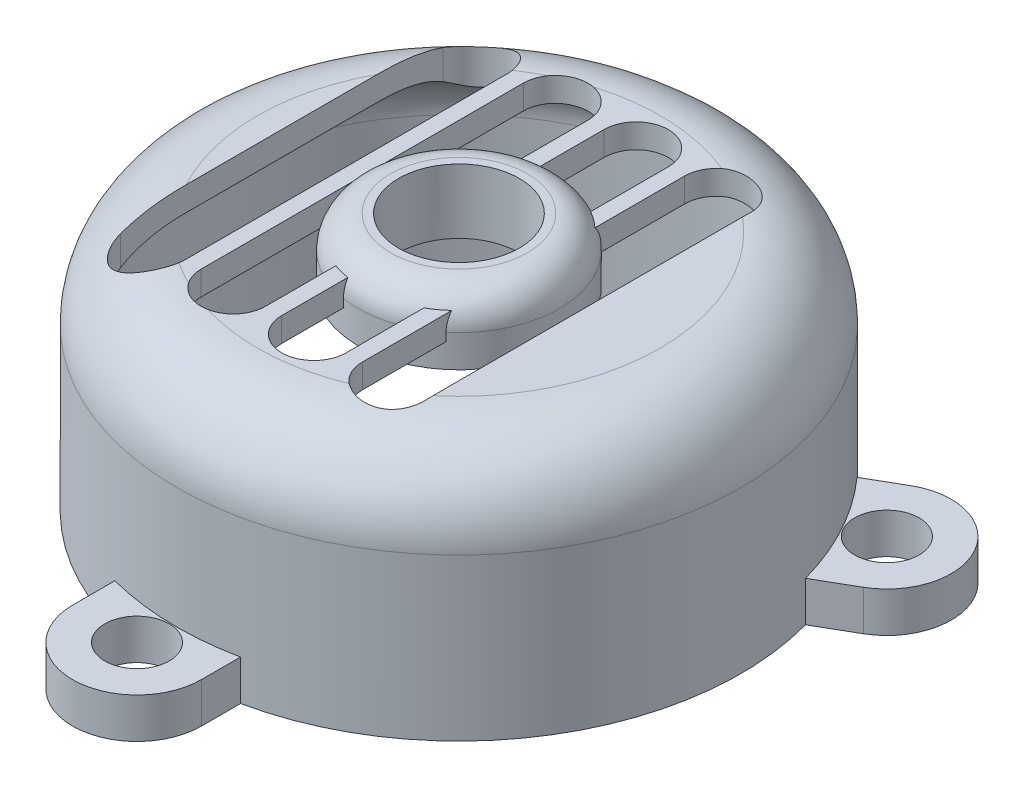
from build123d import *

# Parameters (mm, degrees)
SKETCH1_R                = 35
BOSS_EXTRUDE1_DEPTH      = 30
FILLET1_R                = 10
SHELL1_T                 = -3
SKETCH3_R                = 4
BOSS_EXTRUDE3_DEPTH      = 5
CIRPATTERN2_COUNT        = 3
CUT_EXTRUDE1_DEPTH       = 71.066911791
LPATTERN1_COUNT          = 4
LPATTERN1_PITCH          = 10
BOSS_EXTRUDE4_DEPTH      = 3
BOSS_EXTRUDE4_DEPTH_BACK = 5
SKETCH6_R                = 12.5
FILLET2_R                = 4
SKETCH8_R                = 7.5
CUT_EXTRUDE2_DEPTH       = 71.946262255


with BuildPart() as part:
    # Sketch1 → Boss-Extrude1 (new body)
    with BuildSketch(Plane(origin=(0, 0, 0), x_dir=(1, 0, 0), z_dir=(0, 1, 0))):
        with Locations(Location((0, 0, 0), (0, 0, 270))):
            Circle(SKETCH1_R)
    extrude(amount=BOSS_EXTRUDE1_DEPTH)

    # Fillet1
    fillet1_edges = [part.edges().sort_by_distance(p)[0] for p in [
        (0, 30, -35),
    ]]
    fillet(fillet1_edges, radius=FILLET1_R)

    # Shell1
    shell1_openings = [part.faces().sort_by_distance(p)[0] for p in [
        (0, 0, 0),
    ]]
    offset(amount=SHELL1_T, openings=shell1_openings, kind=Kind.INTERSECTION)

    # Sketch3 → Boss-Extrude3 (add)
    with BuildSketch(Plane.XZ):
        with BuildLine():
            Line((-8.850362272, 32), (7.149637728, 32))
            Line((7.149637728, 32), (7.149637728, 39.116664497))
            ThreePointArc((7.149637728, 39.116664497), (-0.850362272, 47.116664497), (-8.850362272, 39.116664497))
            Line((-8.850362272, 39.116664497), (-8.850362272, 32))
        make_face()
        with Locations(Location((-0.850362272, 39.116664497, 0), (0, 0, 270))):
            Circle(SKETCH3_R, mode=Mode.SUBTRACT)
    boss_extrude3 = extrude(amount=-BOSS_EXTRUDE3_DEPTH)

    # CirPattern2: Boss-Extrude3 ×3 about axis
    cirpattern2_axis = Axis((0, 0, 0), (0, 1, 0))
    for i in range(1, CIRPATTERN2_COUNT):
        add(boss_extrude3.rotate(cirpattern2_axis, i * 360 / CIRPATTERN2_COUNT))

    # Sketch4 → Cut-Extrude1 (cut, through all)
    with BuildSketch(Plane(origin=(0, 30, 0), x_dir=(1, 0, 0), z_dir=(0, 1, 0))):
        with BuildLine():
            Line((-14, 20), (-14, -20))
            ThreePointArc((-14, -20), (-18, -24), (-22, -20))
            Line((-22, -20), (-22, 20))
            ThreePointArc((-22, 20), (-18, 24), (-14, 20))
        make_face()
    cut_extrude1 = extrude(amount=-CUT_EXTRUDE1_DEPTH, mode=Mode.SUBTRACT)

    # LPattern1: Cut-Extrude1 ×4
    with Locations(*[(i * LPATTERN1_PITCH, 0, 0) for i in range(1, LPATTERN1_COUNT)]):
        add(cut_extrude1, mode=Mode.SUBTRACT)

    # Sketch6 → Boss-Extrude4 (add, two sides: drawn at the far end of the back side and taken through both)
    with BuildSketch(Plane.XZ.offset(-27).offset(-BOSS_EXTRUDE4_DEPTH_BACK)):
        with Locations(Location((0, 0, 0), (0, 0, 270))):
            Circle(SKETCH6_R)
    extrude(amount=BOSS_EXTRUDE4_DEPTH + BOSS_EXTRUDE4_DEPTH_BACK)

    # Fillet2
    # the kernel refuses this fillet: 4 mm, written as the material it takes off along each edge
    with BuildSketch(Plane(origin=(0, 32, 0), x_dir=(0, 0, -1), z_dir=(-1, 0, 0))) as fillet2_piece_1_section:
        with BuildLine():
            CenterArc((12.5 - FILLET2_R, FILLET2_R), FILLET2_R, 270, 90)
            Line((12.5 - FILLET2_R, 0), (12.5, 0))
            Line((12.5, 0), (12.5, FILLET2_R))
        make_face()
    fillet2_piece_1 = revolve(axis=Axis((0, 32, 0), (0, -1, 0)), mode=Mode.PRIVATE)
    fillet2_piece_1 = split(fillet2_piece_1, bisect_by=Plane(origin=(-2, 29.038955228, -11.952902195), z_dir=(1, 0, 0)), keep=Keep.TOP, mode=Mode.PRIVATE)
    fillet2_piece_1 = split(fillet2_piece_1, bisect_by=Plane(origin=(6, 29.038955228, -11.952902195), z_dir=(-1, 0, 0)), keep=Keep.TOP, mode=Mode.PRIVATE)
    add(fillet2_piece_1, mode=Mode.SUBTRACT)
    with BuildSketch(Plane(origin=(0, 32, 0), x_dir=(0, 0, -1), z_dir=(-1, 0, 0))) as fillet2_piece_2_section:
        with BuildLine():
            CenterArc((12.5 - FILLET2_R, FILLET2_R), FILLET2_R, 270, 90)
            Line((12.5 - FILLET2_R, 0), (12.5, 0))
            Line((12.5, 0), (12.5, FILLET2_R))
        make_face()
    fillet2_piece_2 = revolve(axis=Axis((0, 32, 0), (0, -1, 0)), mode=Mode.PRIVATE)
    fillet2_piece_2 = split(fillet2_piece_2, bisect_by=Plane(origin=(7.030171784, 30, -9.028587229), z_dir=(0, 1, 0)), keep=Keep.TOP, mode=Mode.PRIVATE)
    add(fillet2_piece_2, mode=Mode.SUBTRACT)
    with BuildSketch(Plane(origin=(0, 32, 0), x_dir=(0, 0, -1), z_dir=(-1, 0, 0))) as fillet2_piece_3_section:
        with BuildLine():
            CenterArc((12.5 - FILLET2_R, FILLET2_R), FILLET2_R, 270, 90)
            Line((12.5 - FILLET2_R, 0), (12.5, 0))
            Line((12.5, 0), (12.5, FILLET2_R))
        make_face()
    fillet2_piece_3 = revolve(axis=Axis((0, 32, 0), (0, -1, 0)), mode=Mode.PRIVATE)
    fillet2_piece_3 = split(fillet2_piece_3, bisect_by=Plane(origin=(8, 29.040323241, 0), z_dir=(1, 0, 0)), keep=Keep.TOP, mode=Mode.PRIVATE)
    add(fillet2_piece_3, mode=Mode.SUBTRACT)
    with BuildSketch(Plane(origin=(0, 32, 0), x_dir=(0, 0, -1), z_dir=(-1, 0, 0))) as fillet2_piece_4_section:
        with BuildLine():
            CenterArc((12.5 - FILLET2_R, FILLET2_R), FILLET2_R, 270, 90)
            Line((12.5 - FILLET2_R, 0), (12.5, 0))
            Line((12.5, 0), (12.5, FILLET2_R))
        make_face()
    fillet2_piece_4 = revolve(axis=Axis((0, 32, 0), (0, -1, 0)), mode=Mode.PRIVATE)
    fillet2_piece_4 = split(fillet2_piece_4, bisect_by=Plane(origin=(-4, 28.348801916, 9.214794735), z_dir=(-1, 0, 0)), keep=Keep.TOP, mode=Mode.PRIVATE)
    fillet2_piece_4 = split(fillet2_piece_4, bisect_by=Plane(origin=(-12, 28.348801916, 9.214794735), z_dir=(1, 0, 0)), keep=Keep.TOP, mode=Mode.PRIVATE)
    add(fillet2_piece_4, mode=Mode.SUBTRACT)

    # Sketch8 → Cut-Extrude2 (cut, through all)
    with BuildSketch(Plane(origin=(0, 32, 0), x_dir=(1, 0, 0), z_dir=(0, 1, 0))):
        with Locations(Location((0, 0, 0), (0, 0, 270))):
            Circle(SKETCH8_R)
    extrude(amount=-CUT_EXTRUDE2_DEPTH, mode=Mode.SUBTRACT)


solid = part.part
